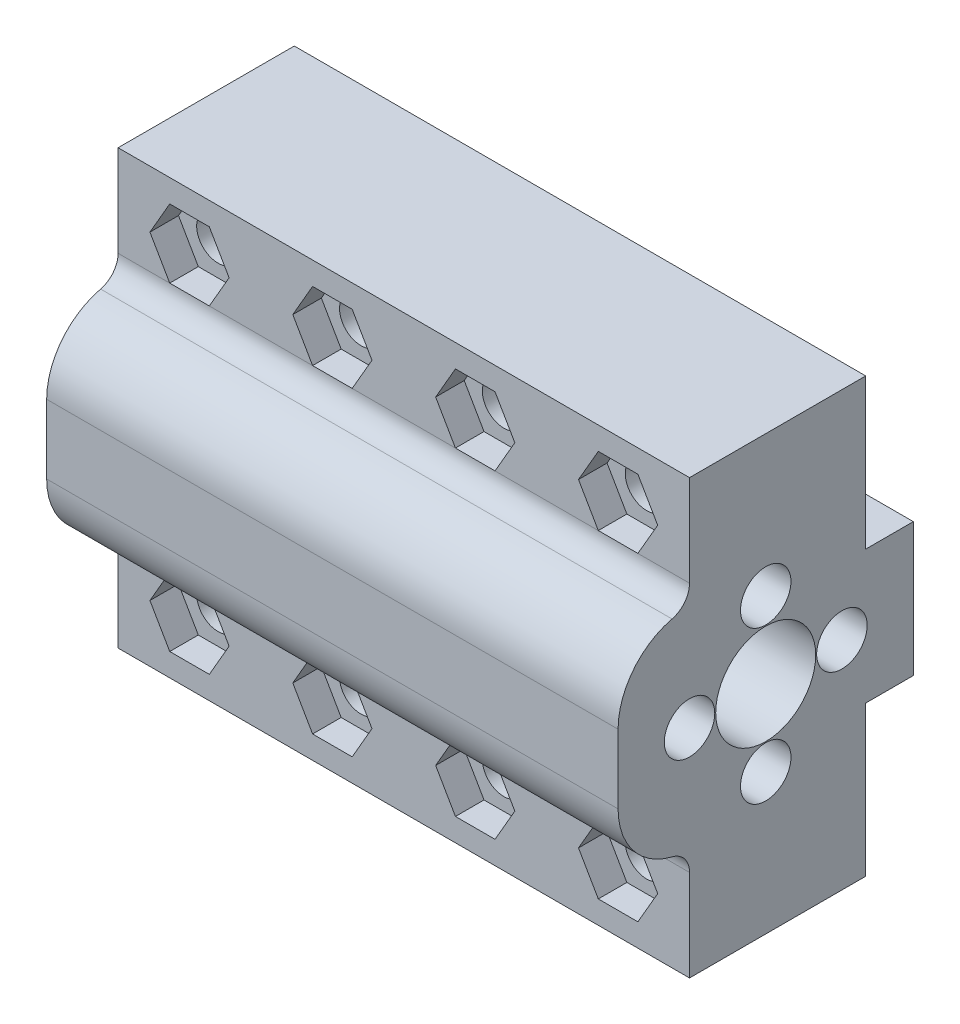
from build123d import *

# Parameters (mm, degrees)
SKETCH2_R           = 5.25
BOSS_EXTRUDE1_DEPTH = 30
SKETCH4_R           = 11.5
CUT_EXTRUDE1_DEPTH  = 30
CUT_EXTRUDE2_REACH  = 42.716
SKETCH5_R           = 1.75
SKETCH6_R           = 2.65
CUT_EXTRUDE3_DEPTH  = 5.3
CUT_EXTRUDE4_REACH  = 50.771
SKETCH8_R           = 2.25
CUT_EXTRUDE6_REACH  = 68.014
SKETCH10_W          = 7.5
SKETCH10_H          = 12
CUT_EXTRUDE5_DEPTH  = 3
FILLET2_R           = 2.4
FILLET3_R           = 7.4


with BuildPart() as part:
    # Sketch2 → Boss-Extrude1 (new, symmetric)
    with BuildSketch(Plane(origin=(0, 0, 0), x_dir=(0, 0, -1), z_dir=(1, 0, 0))):
        Polygon((-15.5, 22.75), (-15.5, -22.75), (10.5, -22.75), (10.5, -7), (15.5, -7), (15.5, 7), (10.5, 7), (10.5, 22.75), align=None)
        Circle(SKETCH2_R, mode=Mode.SUBTRACT)
    extrude(amount=BOSS_EXTRUDE1_DEPTH, both=True)

    # Sketch4 → Cut-Extrude1 (cut)
    with BuildSketch(Plane.ZY.offset(30)):
        Circle(SKETCH4_R)
    extrude(amount=-CUT_EXTRUDE1_DEPTH, mode=Mode.SUBTRACT)

    # Sketch5 → Cut-Extrude2 (cut, up to next)
    with BuildSketch(Plane.ZY, mode=Mode.PRIVATE) as cut_extrude2_sk1:
        with Locations((0, 8)):
            Circle(SKETCH5_R)
    cut_extrude2_tool1 = extrude(cut_extrude2_sk1.sketch, amount=-CUT_EXTRUDE2_REACH, mode=Mode.PRIVATE) & part.part
    # Sketch5 → Cut-Extrude2 (cut, up to next)
    with BuildSketch(Plane.ZY, mode=Mode.PRIVATE) as cut_extrude2_sk2:
        with Locations((8, 0)):
            Circle(SKETCH5_R)
    cut_extrude2_tool2 = extrude(cut_extrude2_sk2.sketch, amount=-CUT_EXTRUDE2_REACH, mode=Mode.PRIVATE) & part.part
    # Sketch5 → Cut-Extrude2 (cut, up to next)
    with BuildSketch(Plane.ZY, mode=Mode.PRIVATE) as cut_extrude2_sk3:
        with Locations((0, -8)):
            Circle(SKETCH5_R)
    cut_extrude2_tool3 = extrude(cut_extrude2_sk3.sketch, amount=-CUT_EXTRUDE2_REACH, mode=Mode.PRIVATE) & part.part
    # Sketch5 → Cut-Extrude2 (cut, up to next)
    with BuildSketch(Plane.ZY, mode=Mode.PRIVATE) as cut_extrude2_sk4:
        with Locations((-8, 0)):
            Circle(SKETCH5_R)
    cut_extrude2_tool4 = extrude(cut_extrude2_sk4.sketch, amount=-CUT_EXTRUDE2_REACH, mode=Mode.PRIVATE) & part.part
    add(cut_extrude2_tool1.solids().sort_by_distance((0, 8, 0))[0], mode=Mode.SUBTRACT)
    add(cut_extrude2_tool2.solids().sort_by_distance((0, 0, 8))[0], mode=Mode.SUBTRACT)
    add(cut_extrude2_tool3.solids().sort_by_distance((0, -8, 0))[0], mode=Mode.SUBTRACT)
    add(cut_extrude2_tool4.solids().sort_by_distance((0, 0, -8))[0], mode=Mode.SUBTRACT)

    # Sketch6 → Cut-Extrude3 (cut)
    with BuildSketch(Plane(origin=(30, 0, 0), x_dir=(0, 0, -1), z_dir=(1, 0, 0))):
        with Locations((0, 8)):
            Circle(SKETCH6_R)
        with Locations((8, 0)):
            Circle(SKETCH6_R)
        with Locations((0, -8)):
            Circle(SKETCH6_R)
        with Locations((-8, 0)):
            Circle(SKETCH6_R)
    extrude(amount=-CUT_EXTRUDE3_DEPTH, mode=Mode.SUBTRACT)

    # Sketch8 → Cut-Extrude4 (cut, up to next)
    with BuildSketch(Plane.XY.offset(15.5), mode=Mode.PRIVATE) as cut_extrude4_sk1:
        with Locations((-22.5, 16.75)):
            Circle(SKETCH8_R)
    cut_extrude4_tool1 = extrude(cut_extrude4_sk1.sketch, amount=-CUT_EXTRUDE4_REACH, mode=Mode.PRIVATE) & part.part
    # Sketch8 → Cut-Extrude4 (cut, up to next)
    with BuildSketch(Plane.XY.offset(15.5), mode=Mode.PRIVATE) as cut_extrude4_sk2:
        with Locations((-7.5, 16.75)):
            Circle(SKETCH8_R)
    cut_extrude4_tool2 = extrude(cut_extrude4_sk2.sketch, amount=-CUT_EXTRUDE4_REACH, mode=Mode.PRIVATE) & part.part
    # Sketch8 → Cut-Extrude4 (cut, up to next)
    with BuildSketch(Plane.XY.offset(15.5), mode=Mode.PRIVATE) as cut_extrude4_sk3:
        with Locations((7.5, 16.75)):
            Circle(SKETCH8_R)
    cut_extrude4_tool3 = extrude(cut_extrude4_sk3.sketch, amount=-CUT_EXTRUDE4_REACH, mode=Mode.PRIVATE) & part.part
    # Sketch8 → Cut-Extrude4 (cut, up to next)
    with BuildSketch(Plane.XY.offset(15.5), mode=Mode.PRIVATE) as cut_extrude4_sk4:
        with Locations((22.5, 16.75)):
            Circle(SKETCH8_R)
    cut_extrude4_tool4 = extrude(cut_extrude4_sk4.sketch, amount=-CUT_EXTRUDE4_REACH, mode=Mode.PRIVATE) & part.part
    # Sketch8 → Cut-Extrude4 (cut, up to next)
    with BuildSketch(Plane.XY.offset(15.5), mode=Mode.PRIVATE) as cut_extrude4_sk5:
        with Locations(Location((22.5, -16.75, 0), (0, 0, 270))):
            Circle(SKETCH8_R)
    cut_extrude4_tool5 = extrude(cut_extrude4_sk5.sketch, amount=-CUT_EXTRUDE4_REACH, mode=Mode.PRIVATE) & part.part
    # Sketch8 → Cut-Extrude4 (cut, up to next)
    with BuildSketch(Plane.XY.offset(15.5), mode=Mode.PRIVATE) as cut_extrude4_sk6:
        with Locations(Location((7.5, -16.75, 0), (0, 0, 270))):
            Circle(SKETCH8_R)
    cut_extrude4_tool6 = extrude(cut_extrude4_sk6.sketch, amount=-CUT_EXTRUDE4_REACH, mode=Mode.PRIVATE) & part.part
    # Sketch8 → Cut-Extrude4 (cut, up to next)
    with BuildSketch(Plane.XY.offset(15.5), mode=Mode.PRIVATE) as cut_extrude4_sk7:
        with Locations(Location((-7.5, -16.75, 0), (0, 0, 270))):
            Circle(SKETCH8_R)
    cut_extrude4_tool7 = extrude(cut_extrude4_sk7.sketch, amount=-CUT_EXTRUDE4_REACH, mode=Mode.PRIVATE) & part.part
    # Sketch8 → Cut-Extrude4 (cut, up to next)
    with BuildSketch(Plane.XY.offset(15.5), mode=Mode.PRIVATE) as cut_extrude4_sk8:
        with Locations(Location((-22.5, -16.75, 0), (0, 0, 270))):
            Circle(SKETCH8_R)
    cut_extrude4_tool8 = extrude(cut_extrude4_sk8.sketch, amount=-CUT_EXTRUDE4_REACH, mode=Mode.PRIVATE) & part.part
    add(cut_extrude4_tool1.solids().sort_by_distance((-22.5, 16.75, 15.5))[0], mode=Mode.SUBTRACT)
    add(cut_extrude4_tool2.solids().sort_by_distance((-7.5, 16.75, 15.5))[0], mode=Mode.SUBTRACT)
    add(cut_extrude4_tool3.solids().sort_by_distance((7.5, 16.75, 15.5))[0], mode=Mode.SUBTRACT)
    add(cut_extrude4_tool4.solids().sort_by_distance((22.5, 16.75, 15.5))[0], mode=Mode.SUBTRACT)
    add(cut_extrude4_tool5.solids().sort_by_distance((22.5, -16.75, 15.5))[0], mode=Mode.SUBTRACT)
    add(cut_extrude4_tool6.solids().sort_by_distance((7.5, -16.75, 15.5))[0], mode=Mode.SUBTRACT)
    add(cut_extrude4_tool7.solids().sort_by_distance((-7.5, -16.75, 15.5))[0], mode=Mode.SUBTRACT)
    add(cut_extrude4_tool8.solids().sort_by_distance((-22.5, -16.75, 15.5))[0], mode=Mode.SUBTRACT)

    # Sketch10 → Cut-Extrude6 (cut, up to next)
    with BuildSketch(Plane(origin=(30, 0, 0), x_dir=(0, 0, -1), z_dir=(1, 0, 0)), mode=Mode.PRIVATE) as cut_extrude6_sk1:
        with Locations((-11.75, 16.75)):
            Rectangle(SKETCH10_W, SKETCH10_H)
    cut_extrude6_tool1 = extrude(cut_extrude6_sk1.sketch, amount=-CUT_EXTRUDE6_REACH, mode=Mode.PRIVATE) & part.part
    # Sketch10 → Cut-Extrude6 (cut, up to next)
    with BuildSketch(Plane(origin=(30, 0, 0), x_dir=(0, 0, -1), z_dir=(1, 0, 0)), mode=Mode.PRIVATE) as cut_extrude6_sk2:
        with Locations((-11.75, -16.75)):
            Rectangle(SKETCH10_W, SKETCH10_H)
    cut_extrude6_tool2 = extrude(cut_extrude6_sk2.sketch, amount=-CUT_EXTRUDE6_REACH, mode=Mode.PRIVATE) & part.part
    add(cut_extrude6_tool1.solids().sort_by_distance((30, 16.75, 11.75))[0], mode=Mode.SUBTRACT)
    add(cut_extrude6_tool2.solids().sort_by_distance((30, -16.75, 11.75))[0], mode=Mode.SUBTRACT)

    # Sketch9 → Cut-Extrude5 (cut)
    with BuildSketch(Plane.XY.offset(8)):
        Polygon((-3.343078062, 16.75), (-5.421539031, 20.35), (-9.578460969, 20.35), (-11.656921938, 16.75), (-9.578460969, 13.15), (-5.421539031, 13.15), align=None)
        Polygon((-18.343078062, 16.75), (-20.421539031, 20.35), (-24.578460969, 20.35), (-26.656921938, 16.75), (-24.578460969, 13.15), (-20.421539031, 13.15), align=None)
        Polygon((11.656921938, 16.75), (9.578460969, 20.35), (5.421539031, 20.35), (3.343078062, 16.75), (5.421539031, 13.15), (9.578460969, 13.15), align=None)
        Polygon((26.656921938, 16.75), (24.578460969, 20.35), (20.421539031, 20.35), (18.343078062, 16.75), (20.421539031, 13.15), (24.578460969, 13.15), align=None)
        Polygon((24.578460969, -13.15), (26.656921938, -16.75), (24.578460969, -20.35), (20.421539031, -20.35), (18.343078062, -16.75), (20.421539031, -13.15), align=None)
        Polygon((9.578460969, -13.15), (11.656921938, -16.75), (9.578460969, -20.35), (5.421539031, -20.35), (3.343078062, -16.75), (5.421539031, -13.15), align=None)
        Polygon((-5.421539031, -13.15), (-3.343078062, -16.75), (-5.421539031, -20.35), (-9.578460969, -20.35), (-11.656921938, -16.75), (-9.578460969, -13.15), align=None)
        Polygon((-20.421539031, -13.15), (-18.343078062, -16.75), (-20.421539031, -20.35), (-24.578460969, -20.35), (-26.656921938, -16.75), (-24.578460969, -13.15), align=None)
    extrude(amount=-CUT_EXTRUDE5_DEPTH, mode=Mode.SUBTRACT)

    # Fillet2
    fillet2_edges = [part.edges().sort_by_distance(p)[0] for p in [
        (0, 10.75, 8),
        (0, -10.75, 8),
    ]]
    fillet(fillet2_edges, radius=FILLET2_R - 0.0001)  # a hair under: the kernel refuses the full size

    # Fillet3
    fillet3_edges = [part.edges().sort_by_distance(p)[0] for p in [
        (0, -10.75, 15.5),
        (0, 10.75, 15.5),
    ]]
    fillet(fillet3_edges, radius=FILLET3_R)


solid = part.part
